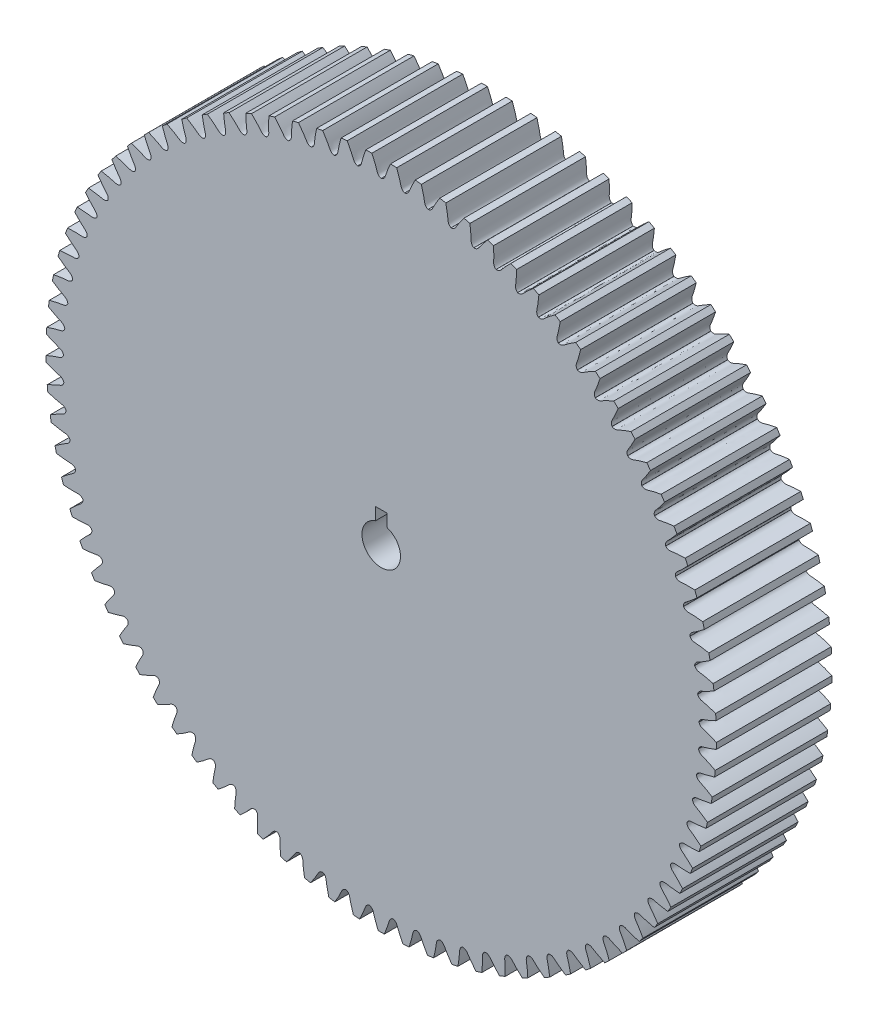
from build123d import *

# Parameters (mm, degrees)
SKETCH_1_R               = 87
EXTRUDE_1_DEPTH          = 30
CUT_EXTRUDE_1_DEPTH      = 127.641225515
PATTERN_CIRCULAR_1_COUNT = 85
CUT_EXTRUDE_2_DEPTH      = 127.638657662


with BuildPart() as part:
    # 草图1 → 凸台-拉伸1 (new body)
    with BuildSketch(Plane.XY):
        Circle(SKETCH_1_R)
    extrude(amount=EXTRUDE_1_DEPTH)

    # 草图2 → 切除-拉伸1 (cut, through all)
    with BuildSketch(Plane.XY):
        with BuildLine():
            ThreePointArc((0.01, 82.498728755), (0, 82.498729361), (-0.01, 82.498728755))
            add(Edge.make_bspline(
                [(-0.01, 82.498728755), (-0.867190026, 82.722306355), (-1.04677445, 83.560192092), (-1.396411054, 84.52303407), (-1.595738983, 85.056236861), (-1.818987661, 85.614127829), (-2.065361579, 86.19713427), (-2.336488925, 86.804199297), (-2.6332694, 87.434653624), (-2.956786428, 88.087673854), (-3.308042728, 88.762439527), (-3.688035253, 89.458088658), (-4.097732606, 90.173731227), (-4.538080414, 90.908446086), (-5.009998738, 91.661282639), (-5.514381769, 92.43126118), (-6.052096891, 93.217373644), (-6.623983957, 94.018584268), (-7.230854495, 94.833830296), (-7.873491054, 95.662022704), (-8.552646151, 96.502046938), (-9.521562393, 97.652629075), (-10.284931399, 98.50510302), (-10.81193944, 99.071096838)],
                knots=[0, 0, 0, 0, 0.098795328, 0.12570218, 0.154209799, 0.184318183, 0.216027332, 0.249337247, 0.284247927, 0.320759373, 0.358871585, 0.398584562, 0.439898305, 0.482812813, 0.527328087, 0.573444126, 0.621160931, 0.670478501, 0.721396837, 0.773915939, 0.828035806, 0.883756438, 1, 1, 1, 1], degree=3))
            ThreePointArc((-10.81193944, 99.071096838), (0, 99.659321005), (10.81193944, 99.071096838))
            add(Edge.make_bspline(
                [(0.01, 82.498728755), (0.867190026, 82.722306355), (1.04677445, 83.560192092), (1.396411054, 84.52303407), (1.595738983, 85.056236861), (1.818987661, 85.614127829), (2.065361579, 86.19713427), (2.336488925, 86.804199297), (2.6332694, 87.434653624), (2.956786428, 88.087673854), (3.308042728, 88.762439527), (3.688035253, 89.458088658), (4.097732606, 90.173731227), (4.538080414, 90.908446086), (5.009998738, 91.661282639), (5.514381769, 92.43126118), (6.052096891, 93.217373644), (6.623983957, 94.018584268), (7.230854495, 94.833830296), (7.873491054, 95.662022704), (8.552646151, 96.502046938), (9.521562393, 97.652629075), (10.284931399, 98.50510302), (10.81193944, 99.071096838)],
                knots=[0, 0, 0, 0, 0.098795328, 0.12570218, 0.154209799, 0.184318183, 0.216027332, 0.249337247, 0.284247927, 0.320759373, 0.358871585, 0.398584562, 0.439898305, 0.482812813, 0.527328087, 0.573444126, 0.621160931, 0.670478501, 0.721396837, 0.773915939, 0.828035806, 0.883756438, 1, 1, 1, 1], degree=3))
        make_face()
    cut_extrude_1 = extrude(amount=CUT_EXTRUDE_1_DEPTH, mode=Mode.SUBTRACT)

    # 阵列(圆周)1: 切除-拉伸1 ×85 about axis
    pattern_circular_1_axis = Axis((0, 0, -1.5), (0, 0, 1))
    for i in range(1, PATTERN_CIRCULAR_1_COUNT):
        add(cut_extrude_1.rotate(pattern_circular_1_axis, i * 360 / PATTERN_CIRCULAR_1_COUNT), mode=Mode.SUBTRACT)

    # 草图4 → 切除-拉伸2 (cut, through all)
    with BuildSketch(Plane.XY.offset(30)):
        with BuildLine():
            Line((1.5, 4.769696007), (1.5, 8))
            Line((1.5, 8), (-1.5, 8))
            Line((-1.5, 8), (-1.5, 4.769696007))
            ThreePointArc((-1.5, 4.769696007), (0, -5), (1.5, 4.769696007))
        make_face()
    extrude(amount=-CUT_EXTRUDE_2_DEPTH, mode=Mode.SUBTRACT)


solid = part.part
